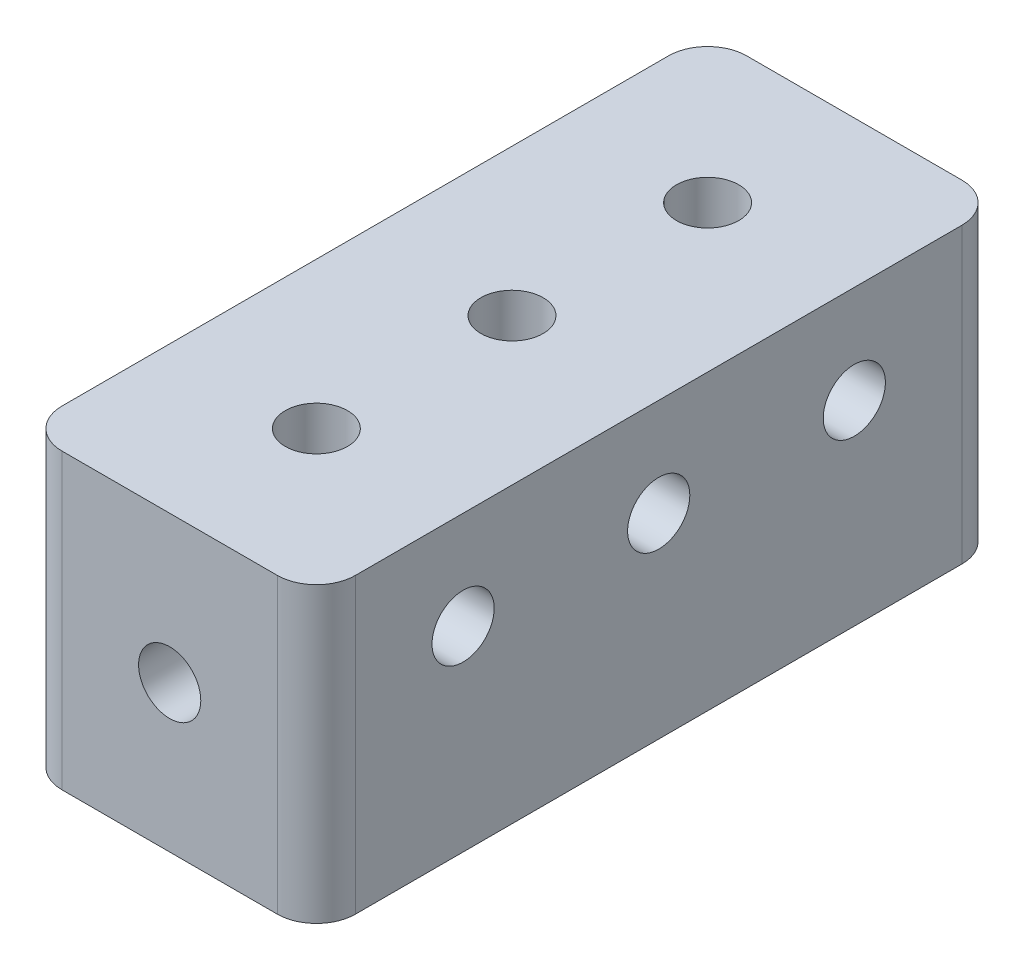
from build123d import *

# Parameters (mm, degrees)
SKETCH1_W           = 19.05
SKETCH1_H           = 44.45
BOSS_EXTRUDE1_DEPTH = 9.525
SKETCH2_R           = 2.0193
CUT_EXTRUDE1_DEPTH  = 9.525
CUT_EXTRUDE2_START  = -9.525
SKETCH3_R           = 2.0193
CUT_EXTRUDE2_DEPTH  = 9.525
SKETCH4_R           = 2.0193
CUT_EXTRUDE3_DEPTH  = 6.35
CUT_EXTRUDE4_START  = -6.35
SKETCH5_R           = 2.0193
CUT_EXTRUDE4_DEPTH  = 6.35
SKETCH6_R           = 2.0193
CUT_EXTRUDE5_DEPTH  = 6.35
FILLET1_R           = 2.54


with BuildPart() as part:
    # Sketch1 → Boss-Extrude1 (new, symmetric)
    with BuildSketch(Plane(origin=(0, 0, 0), x_dir=(1, 0, 0), z_dir=(0, 1, 0))):
        Rectangle(SKETCH1_W, SKETCH1_H)
    extrude(amount=BOSS_EXTRUDE1_DEPTH, both=True)

    # Sketch2 → Cut-Extrude1 (cut)
    with BuildSketch(Plane.XY.offset(22.225)):
        Circle(SKETCH2_R)
    extrude(amount=-CUT_EXTRUDE1_DEPTH, mode=Mode.SUBTRACT)

    # Sketch3 → Cut-Extrude2 (cut)
    with BuildSketch(Plane(origin=(0, 0, -22.225), x_dir=(-1, 0, 0), z_dir=(0, 0, -1)).offset(CUT_EXTRUDE2_START)):
        Circle(SKETCH3_R)
    extrude(amount=CUT_EXTRUDE2_DEPTH, mode=Mode.SUBTRACT)

    # Sketch4 → Cut-Extrude3 (cut)
    with BuildSketch(Plane(origin=(9.525, 0, 0), x_dir=(0, 0, -1), z_dir=(1, 0, 0))):
        with Locations((-12.7, 3.175)):
            Circle(SKETCH4_R)
        with Locations((12.7, 3.175)):
            Circle(SKETCH4_R)
        with Locations((0, 3.175)):
            Circle(SKETCH4_R)
    extrude(amount=-CUT_EXTRUDE3_DEPTH, mode=Mode.SUBTRACT)

    # Sketch5 → Cut-Extrude4 (cut)
    with BuildSketch(Plane.ZY.offset(9.525).offset(CUT_EXTRUDE4_START)):
        with Locations((-12.7, 3.175)):
            Circle(SKETCH5_R)
        with Locations((0, 3.175)):
            Circle(SKETCH5_R)
        with Locations((12.7, 3.175)):
            Circle(SKETCH5_R)
    extrude(amount=CUT_EXTRUDE4_DEPTH, mode=Mode.SUBTRACT)

    # Sketch6 → Cut-Extrude5 (cut)
    with BuildSketch(Plane(origin=(0, 9.525, 0), x_dir=(1, 0, 0), z_dir=(0, 1, 0))):
        with Locations((0, 12.7)):
            Circle(SKETCH6_R)
        Circle(SKETCH6_R)
        with Locations((0, -12.7)):
            Circle(SKETCH6_R)
    extrude(amount=-CUT_EXTRUDE5_DEPTH, mode=Mode.SUBTRACT)

    # Fillet1
    fillet1_edges = [part.edges().sort_by_distance(p)[0] for p in [
        (9.525, 0, 22.225),
        (-9.525, 0, 22.225),
        (-9.525, 0, -22.225),
        (9.525, 0, -22.225),
    ]]
    fillet(fillet1_edges, radius=FILLET1_R)


solid = part.part
